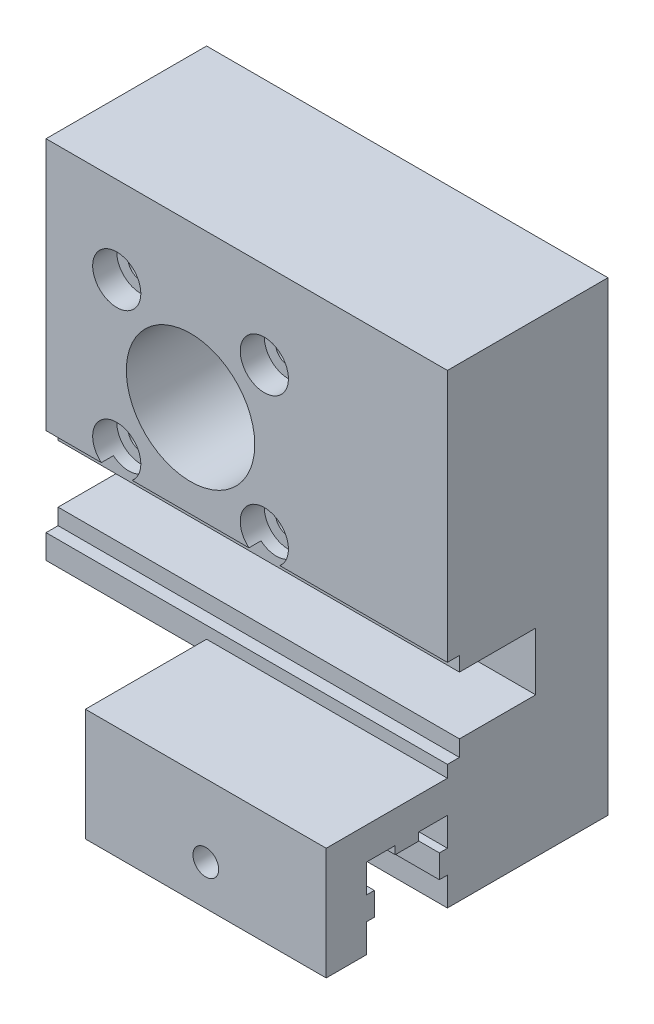
from build123d import *

# Parameters (mm, degrees)
ESQUISSE1_W                     = 50
ESQUISSE1_H                     = 45
MAIN_EXTRUSION_DEPTH            = 20
ESQUISSE5_R                     = 8
GEAR_LINEAR_HOLES_DEPTH         = 40.131189606
FIXING_EXTRUSION_DEPTH          = 25
ESQUISSE13_W                    = 50
ESQUISSE13_H                    = 7.2
ROLLINGBALLHORIZONTALHOLE_DEPTH = 11
FRONTHOLE_DEPTH                 = 20
ESQUISSE15_R                    = 1.6
BOTTOMFIXINGHOLE_DEPTH          = 56.832427853
ESQUISSE12_R                    = 16
REDUCTORMAINHOLE_DEPTH          = 5
REDUCTORFRONTFIXINGHOLE_DEPTH   = 3
ESQUISSE17_R                    = 1.6
MOTORFIXINGHOLE_DEPTH           = 53.832376437
ESQUISSE19_R                    = 3
ENL_V_MAT_EXTRU_5_DEPTH         = 3
SKETCH2_W                       = 1.5
SKETCH2_H                       = 11
CUTFORMAKERBEAMPROFILE_DEPTH    = 71.655926857


with BuildPart() as part:
    # Esquisse1 → Main Extrusion (new body)
    with BuildSketch(Plane.XY):
        Rectangle(ESQUISSE1_W, ESQUISSE1_H)
    extrude(amount=MAIN_EXTRUSION_DEPTH)

    # Esquisse5 → Gear Linear Holes (cut, through all)
    with BuildSketch(Plane.XY.offset(20)):
        with Locations((-7, 2.5)):
            Circle(ESQUISSE5_R)
    extrude(amount=-GEAR_LINEAR_HOLES_DEPTH, mode=Mode.SUBTRACT)

    # Esquisse8 → Fixing Extrusion (add, symmetric)
    with BuildSketch(Plane(origin=(0, 0, 0), x_dir=(0, 0, -1), z_dir=(1, 0, 0))):
        Polygon((-20, -25.5), (-20, -29.05), (-21, -29.05), (-21, -31.95), (-20, -31.95), (-20, -35.5), (0, -35.5), (0, -21.5), (-35.1, -21.5), (-35.1, -35.5), (-30.1, -35.5), (-30.1, -31.95), (-29.1, -31.95), (-29.1, -29.05), (-30.1, -29.05), (-30.1, -25.5), (-26.5, -25.5), (-26.5, -26.5), (-23.6, -26.5), (-23.6, -25.5), align=None)
    extrude(amount=FIXING_EXTRUSION_DEPTH, both=True)

    # Esquisse13 → RollingBallHorizontalHole (cut)
    with BuildSketch(Plane.XY.offset(20)):
        with Locations((0, -14.4)):
            Rectangle(ESQUISSE13_W, ESQUISSE13_H)
    extrude(amount=-ROLLINGBALLHORIZONTALHOLE_DEPTH, mode=Mode.SUBTRACT)

    # Esquisse14 → FrontHole (cut)
    with BuildSketch(Plane.ZY.offset(25)):
        Polygon((0, -23), (20, -23), (20, -18), (35.1, -18), (35.1, -35.5), (0, -35.5), align=None)
    extrude(amount=-FRONTHOLE_DEPTH, mode=Mode.SUBTRACT)

    # Esquisse15 → BottomFixingHole (cut, through all)
    with BuildSketch(Plane.XY.offset(35.1)):
        with Locations((10, -30.5)):
            Circle(ESQUISSE15_R)
    extrude(amount=-BOTTOMFIXINGHOLE_DEPTH, mode=Mode.SUBTRACT)

    # Esquisse12 → ReductorMainHole (cut)
    with BuildSketch(Plane.XY):
        with Locations((-7, 2.5)):
            Circle(ESQUISSE12_R)
    extrude(amount=REDUCTORMAINHOLE_DEPTH, mode=Mode.SUBTRACT)

    # Esquisse16 → ReductorFrontFixingHole (cut)
    with BuildSketch(Plane(origin=(0, 0, 5), x_dir=(-1, 0, 0), z_dir=(0, 0, -1))):
        with BuildLine():
            Line((2.641101056, 11.5), (11.358898944, 11.5))
            ThreePointArc((11.358898944, 11.5), (17, 2.5), (11.358898944, -6.5))
            Line((11.358898944, -6.5), (2.641101056, -6.5))
            ThreePointArc((2.641101056, -6.5), (-3, 2.5), (2.641101056, 11.5))
        make_face()
    extrude(amount=-REDUCTORFRONTFIXINGHOLE_DEPTH, mode=Mode.SUBTRACT)

    # Esquisse17 → MotorFixingHole (cut, through all)
    with BuildSketch(Plane(origin=(0, 0, 5), x_dir=(-1, 0, 0), z_dir=(0, 0, -1))):
        with Locations((-2.192388155, 11.692388155)):
            Circle(ESQUISSE17_R)
        with Locations((16.192388155, 11.692388155)):
            Circle(ESQUISSE17_R)
        with Locations((-2.192388155, -6.692388155)):
            Circle(ESQUISSE17_R)
        with Locations((16.192388155, -6.692388155)):
            Circle(ESQUISSE17_R)
    extrude(amount=-MOTORFIXINGHOLE_DEPTH, mode=Mode.SUBTRACT)

    # Esquisse19 → Enlèv. mat.-Extru.5 (cut)
    with BuildSketch(Plane.XY.offset(20)):
        with Locations((-16.192388155, 11.692388155)):
            Circle(ESQUISSE19_R)
        with Locations((2.192388155, 11.692388155)):
            Circle(ESQUISSE19_R)
        with Locations((-16.192388155, -6.692388155)):
            Circle(ESQUISSE19_R)
        with Locations((2.192388155, -6.692388155)):
            Circle(ESQUISSE19_R)
    extrude(amount=-ENL_V_MAT_EXTRU_5_DEPTH, mode=Mode.SUBTRACT)

    # Sketch2 → CutForMakerBeamProfile (cut, through all)
    with BuildSketch(Plane(origin=(25, 0, 0), x_dir=(0, 0, -1), z_dir=(1, 0, 0))):
        with Locations((-19.25, -14.5)):
            Rectangle(SKETCH2_W, SKETCH2_H)
    extrude(amount=-CUTFORMAKERBEAMPROFILE_DEPTH, mode=Mode.SUBTRACT)


solid = part.part
